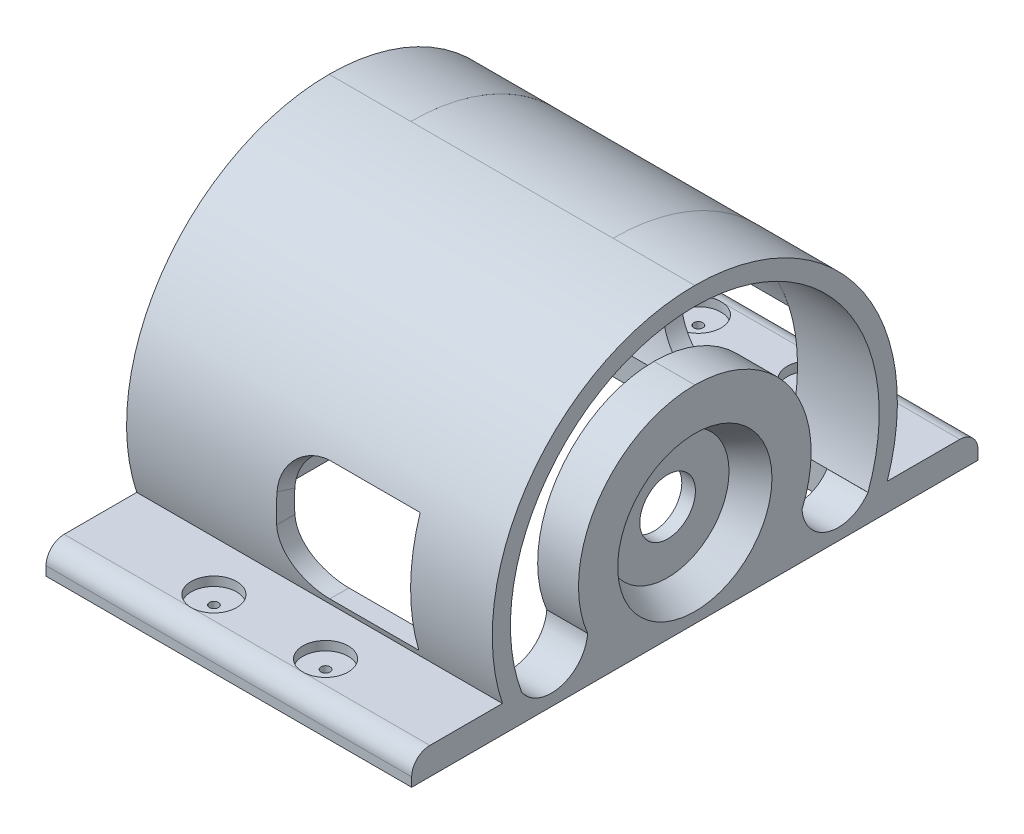
from build123d import *

# Parameters (mm, degrees)
BOSS_EXTRUDE1_DEPTH     = 22.3
SKETCH4_R               = 2.5
CUT_EXTRUDE1_DEPTH      = 1
SKETCH5_R               = 0.5
CUT_EXTRUDE2_DEPTH      = 49.261993328
CUT_EXTRUDE3_DEPTH      = 14.8
FILLET1_R               = 5
BOSS_EXTRUDE2_DEPTH     = 9
FILLET2_R               = 2
FILLET3_R               = 5
SKETCH11_R              = 3.065
BOSS_EXTRUDE3_DEPTH     = 4.5
SKETCH12_R              = 8.5
CUT_EXTRUDE4_DEPTH      = 3
CUT_EXTRUDE4_DRAFT      = -30
MIRROR5_COPY_1_SKETCH_R = 8.5
MIRROR5_COPY_1_DEPTH    = 3
MIRROR5_COPY_1_DRAFT    = -30


# Read off the part's stored shape, not the designer's step: Boss-Extrude2
with BuildPart() as part:
    # Sketch2 → Boss-Extrude1 (new body)
    with BuildSketch(Plane(origin=(0, 0, 0), x_dir=(0, 0, -1), z_dir=(1, 0, 0))):
        with BuildLine():
            Line((-19.08, -7), (-19.08, -10))
            Line((-19.08, -10), (-31.2, -10))
            Line((-31.2, -10), (-31.2, -7))
            Line((-31.2, -7), (-21.2, -7))
            ThreePointArc((-21.2, -7), (-18.082442737, 13.063917612), (0, 22.3))
            ThreePointArc((0, 22.3), (18.082442737, 13.063917612), (21.2, -7))
            Line((21.2, -7), (31.2, -7))
            Line((31.2, -7), (31.2, -10))
            Line((31.2, -10), (19.08, -10))
            Line((19.08, -10), (19.08, -7))
            ThreePointArc((19.08, -7), (16.651833626, 11.620468336), (0, 20.3))
            ThreePointArc((0, 20.3), (-16.651833626, 11.620468336), (-19.08, -7))
        make_face()
    extrude(amount=BOSS_EXTRUDE1_DEPTH)

    # Sketch4 → Cut-Extrude1 (cut)
    with BuildSketch(Plane(origin=(0, -7, 0), x_dir=(1, 0, 0), z_dir=(0, 1, 0))):
        with Locations(Location((5, 26.695, 0), (0, 0, 270))):
            Circle(SKETCH4_R)
        with Locations(Location((17.3, 26.695, 0), (0, 0, 270))):
            Circle(SKETCH4_R)
        with Locations(Location((5, -26.695, 0), (0, 0, 270))):
            Circle(SKETCH4_R)
        with Locations(Location((17.3, -26.695, 0), (0, 0, 270))):
            Circle(SKETCH4_R)
    extrude(amount=-CUT_EXTRUDE1_DEPTH, mode=Mode.SUBTRACT)

    # Sketch5 → Cut-Extrude2 (cut, through all)
    with BuildSketch(Plane(origin=(0, -7, 0), x_dir=(1, 0, 0), z_dir=(0, 1, 0))):
        with Locations(Location((17.3, 26.695, 0), (0, 0, 270))):
            Circle(SKETCH5_R)
        with Locations(Location((5, 26.695, 0), (0, 0, 270))):
            Circle(SKETCH5_R)
        with Locations(Location((5, -26.695, 0), (0, 0, 270))):
            Circle(SKETCH5_R)
        with Locations(Location((17.3, -26.695, 0), (0, 0, 270))):
            Circle(SKETCH5_R)
    extrude(amount=-CUT_EXTRUDE2_DEPTH, mode=Mode.SUBTRACT)

    # Sketch6 → Cut-Extrude3 (cut)
    with BuildSketch(Plane(origin=(22.3, 0, 0), x_dir=(0, 0, -1), z_dir=(1, 0, 0))):
        Polygon((0, 0), (46.533038178, 14.787970064), (46.533038178, -6.309411423), (19, -6.309411423), align=None)
    cut_extrude3 = extrude(amount=-CUT_EXTRUDE3_DEPTH, mode=Mode.SUBTRACT)

    # Fillet1
    fillet1_edges = [part.edges().sort_by_distance(p)[0] for p in [
        (7.5, 6.454741119, -20.311017239),
        (7.5, -6.309411423, -20.366815992),
    ]]
    fillet(fillet1_edges, radius=FILLET1_R)

    # Boss-Extrude2 outline → Boss-Extrude2 (add)
    with BuildSketch(Plane(origin=(22.3, 0, 0), x_dir=(0, 0, -1), z_dir=(1, 0, 0))):
        with BuildLine():
            Line((-19.08, -10), (-19.08, -7))
            ThreePointArc((-19.08, -7), (-16.651833626, 11.620468336), (0, 20.3))
            ThreePointArc((0, 20.3), (0.00031837, 20.299999942), (0.000636741, 20.299999879))
            ThreePointArc((0.000636741, 20.299999879), (16.65523283, 11.62577033), (19.089327288, -6.993924006))
            Line((19.089327288, -6.993924006), (19.0902824, -9.993923854))
            Line((19.0902824, -9.993923854), (31.210281785, -9.990065204))
            Line((31.210281785, -9.990065204), (31.209326674, -6.990065356))
            Line((31.209326674, -6.990065356), (21.209327181, -6.993249061))
            ThreePointArc((21.209327181, -6.993249061), (18.085382316, 13.069674996), (0, 22.3))
            ThreePointArc((0, 22.3), (-18.082442737, 13.063917612), (-21.2, -7))
            Line((-21.2, -7), (-31.2, -7))
            Line((-31.2, -7), (-31.2, -10))
            Line((-31.2, -10), (-19.08, -10))
        make_face()
    boss_extrude2 = extrude(amount=BOSS_EXTRUDE2_DEPTH)

    # Mirror1: Boss-Extrude2 across plane
    add(boss_extrude2.mirror(Plane(origin=(11.15, 0, 0), x_dir=(0, 0, 1), z_dir=(1, 0, 0))))

    # Fillet2
    fillet2_edges = [part.edges().sort_by_distance(p)[0] for p in [
        (26.8, -6.990065356, -31.209326674),
        (-4.5, -6.990065356, -31.209326674),
        (11.15, -7, 31.2),
        (11.15, -7, -31.2),
    ]]
    fillet(fillet2_edges, radius=FILLET2_R)

    # Mirror2: Cut-Extrude3 across plane
    add(cut_extrude3.mirror(Plane.XY), mode=Mode.SUBTRACT)

    # Fillet3
    fillet3_edges = [part.edges().sort_by_distance(p)[0] for p in [
        (7.5, -6.309411423, 20.366815992),
        (7.5, 6.454741119, 20.311017239),
    ]]
    fillet(fillet3_edges, radius=FILLET3_R)

    # Sketch11 → Boss-Extrude3 (add)
    with BuildSketch(Plane(origin=(31.3, 0, 0), x_dir=(0, 0, -1), z_dir=(1, 0, 0))):
        with BuildLine():
            Line((-19.08, -10), (19.087106029, -10))
            Line((19.087106029, -10), (19.087106029, -7))
            ThreePointArc((19.087106029, -7), (14.745407201, -8.568352102), (11.816765825, -5))
            ThreePointArc((11.816765825, -5), (10.685839373, 7.068100067), (0.005794631, 12.800000115))
            Line((0.005794631, 12.800000115), (0.001311398, 12.800000115))
            ThreePointArc((0.001311398, 12.800000115), (-10.678733344, 7.068100067), (-11.809659796, -5))
            ThreePointArc((-11.809659796, -5), (-14.738301172, -8.568352102), (-19.08, -7))
            Line((-19.08, -7), (-19.08, -10))
        make_face()
        with Locations((0.003553015, -0.329999689)):
            Circle(SKETCH11_R, mode=Mode.SUBTRACT)
    boss_extrude3 = extrude(amount=-BOSS_EXTRUDE3_DEPTH)


with BuildPart() as cut_extrude4_tool:
    # Sketch12 → Cut-Extrude4 (with draft: the straight prism first)
    with BuildSketch(Plane(origin=(31.3, 0, 0), x_dir=(0, 0, -1), z_dir=(1, 0, 0))):
        with Locations((0.003553015, -0.329999689)):
            Circle(SKETCH12_R)
    extrude(amount=-CUT_EXTRUDE4_DEPTH)
    # Cut-Extrude4: the draft: its side faces are tilted about the plane it starts from
    cut_extrude4_sides = [cut_extrude4_tool.faces().sort_by_distance(p)[0] for p in [
        (29.8, -0.329999689, 8.496446985),
    ]]
    draft(cut_extrude4_sides, Plane(origin=(31.3, 0, 0), x_dir=(0, 0, -1), z_dir=(1, 0, 0)), CUT_EXTRUDE4_DRAFT)


with BuildPart() as part_1:
    add(part.part)

    # Cut-Extrude4: cut by cut_extrude4_tool
    add(cut_extrude4_tool.part, mode=Mode.SUBTRACT)

    # Mirror4: Boss-Extrude3 across plane
    add(boss_extrude3.mirror(Plane(origin=(11.15, 0, 0), x_dir=(0, 0, 1), z_dir=(1, 0, 0))))


with BuildPart() as mirror5_copy_1_tool:
    # Mirror5 copy 1 sketch → Mirror5 copy 1 (with draft: the straight prism first)
    with BuildSketch(Plane(origin=(-9, 0, 0), x_dir=(0, 0, -1), z_dir=(-1, 0, 0))):
        with Locations((0.003553015, 0.329999689)):
            Circle(MIRROR5_COPY_1_SKETCH_R)
    extrude(amount=-MIRROR5_COPY_1_DEPTH)
    # Mirror5 copy 1: the draft: its side faces are tilted about the plane it starts from
    mirror5_copy_1_sides = [mirror5_copy_1_tool.faces().sort_by_distance(p)[0] for p in [
        (-7.5, -0.329999689, 8.496446985),
    ]]
    draft(mirror5_copy_1_sides, Plane(origin=(-9, 0, 0), x_dir=(0, 0, -1), z_dir=(-1, 0, 0)), MIRROR5_COPY_1_DRAFT)


with BuildPart() as part_2:
    add(part_1.part)

    # Mirror5 copy 1: cut by mirror5_copy_1_tool
    add(mirror5_copy_1_tool.part, mode=Mode.SUBTRACT)


solid = part_2.part
